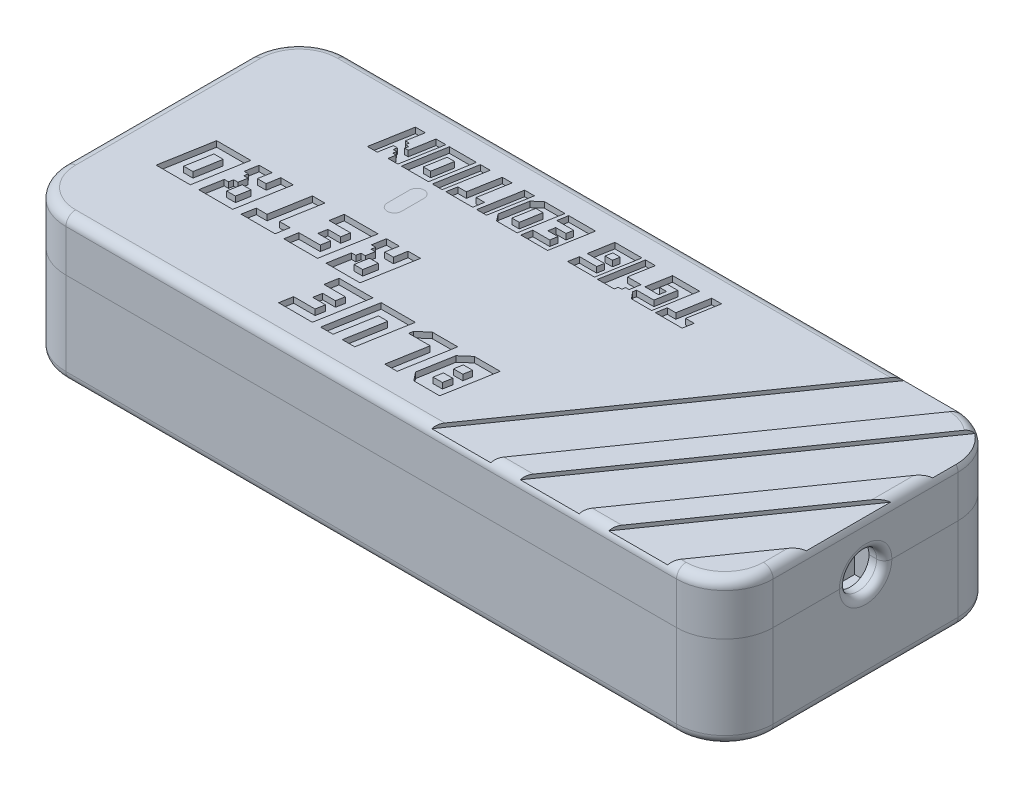
from build123d import *

# Parameters (mm, degrees)
SKETCH1_R                                  = 2
BOSS_EXTRUDE1_DEPTH                        = 0.8
SKETCH2_W                                  = 1.500000048
SKETCH2_H                                  = 4.000000128
BOSS_EXTRUDE2_DEPTH                        = 1
SKETCH3_W                                  = 48.25
SKETCH3_H                                  = 25.72
BOSS_EXTRUDE3_DEPTH                        = 4.15
SKETCH4_W                                  = 4.999999906
SKETCH4_H                                  = 2.000000064
CUT_EXTRUDE1_DEPTH                         = 0.1
SKETCH9_W                                  = 17.77
SKETCH9_H                                  = 15.77
BOSS_EXTRUDE8_DEPTH                        = 3.2
SKETCH23_W                                 = 6.24
SKETCH23_H                                 = 19.54
BOSS_EXTRUDE14_DEPTH                       = 3.32
BOX_SHAPE_DEPTH                            = 6.7945
BOX_SHAPE_DEPTH_BACK                       = 12.250000074
SKETCH5_W                                  = 92.9375
SKETCH5_H                                  = 37.000000128
CORNER_FILLETS_R                           = 6.35
TOP_SHELL_T                                = -2
BOTTOM_SHELL_T                             = -2
PCB_BOSS_HORIZONTAL_DEPTH                  = 1
PCB_BOSS_HORIZONTAL_2_DEPTH                = 1
PCB_BOSS_VERT_PATTERN_1_COUNT              = 2
PCB_BOSS_VERT_PATTERN_1_ANGLE              = 90
PCB_BOSS_VERT_PATTERN_2_COUNT              = 2
PCB_BOSS_VERT_PATTERN_2_ANGLE              = 90
SKETCH7_R                                  = 2.45
SKETCH7_R_2                                = 1.95
PCB_BOSS_EDGE_BREAK_DEPTH                  = 96.55093624
PCB_PCB_TOP_CATCH_REACH                    = 97.756
SKETCH8_R                                  = 3
SKETCH8_R_2                                = 2
BOSS_NOTCH_FOR_ESP32_REACH                 = 96.657
SKETCH10_W                                 = 3.175
SKETCH10_H                                 = 6.35
SHORT_SIDE_SNAP_FIT_FEMALE_DEPTH           = 11.5
SNAP_FIT_FILL_FOR_CORD_HOLE_REACH          = 99.513
SKETCH24_W                                 = 6.35
SKETCH24_H                                 = 3.7011433
LONG_SIDE_SNP_FIT_FEMALE_DEPTH             = 39.46875
SHORT_SIDE_SNAP_FIT_MALE_DEPTH             = 10.5
SHORT_SIDE_SNAP_FIT_MALE_DEPTH_BACK        = 10.5
LONG_SIDE_SNP_FIT_MALE_DEPTH               = 38.46875
LONG_SIDE_SNP_FIT_MALE_DEPTH_BACK          = 38.46875
SKETCH15_R                                 = 2.45
CORD_HOLE_CUT_DEPTH                        = 2
SNAPFIT_MALE_REMOVAL_FOR_CORD_HOLE_1_REACH = 97.65
SKETCH25_W                                 = 8.35
SKETCH25_H                                 = 7.7945
SKETCH26_W                                 = 8.35
SKETCH26_H                                 = 2.95
SNAPFIT_MALE_REMOVAL_FOR_CORD_HOLE_2_DEPTH = 98.512519281
CORD_HOLE_FILLET_BOTTOM_R                  = 1
CORD_HOLE_FILLET_TOP_R                     = 1
LED_HOLE_DEPTH                             = 2
TOP_EDGE_FILLET_R                          = 1.27
DIAG_LINES_CUT_DEPTH                       = 0.5
TEXT_CUT_DEPTH                             = 0.75
BOTTOM_EDGE_FILLET_R                       = 1.27
LED_DIFFUSER_MOCK_DEPTH                    = 1


with BuildPart() as part:
    # Sketch1 → Boss-Extrude1 (new, symmetric)
    with BuildSketch(Plane(origin=(0, 0, 0), x_dir=(1, 0, 0), z_dir=(0, 1, 0))):
        with BuildLine():
            Line((2, 0), (79, 0))
            ThreePointArc((79, 0), (80.414213562, 0.585786438), (81, 2))
            Line((81, 2), (81, 27))
            ThreePointArc((81, 27), (80.414213562, 28.414213562), (79, 29))
            Line((79, 29), (2, 29))
            ThreePointArc((2, 29), (0.585786438, 28.414213562), (0, 27))
            Line((0, 27), (0, 2))
            ThreePointArc((0, 2), (0.585786438, 0.585786438), (2, 0))
        make_face()
        with Locations(Location((4, 4, 0), (0, 0, 270))):
            Circle(SKETCH1_R, mode=Mode.SUBTRACT)
        with Locations(Location((4, 25, 0), (0, 0, 270))):
            Circle(SKETCH1_R, mode=Mode.SUBTRACT)
        with Locations(Location((77, 25, 0), (0, 0, 270))):
            Circle(SKETCH1_R, mode=Mode.SUBTRACT)
        with Locations(Location((77, 4, 0), (0, 0, 270))):
            Circle(SKETCH1_R, mode=Mode.SUBTRACT)
    extrude(amount=BOSS_EXTRUDE1_DEPTH, both=True)

    # Sketch2 → Boss-Extrude2 (add)
    with BuildSketch(Plane(origin=(0, 0.8, 0), x_dir=(1, 0, 0), z_dir=(0, 1, 0))):
        with Locations((23, 20)):
            Rectangle(SKETCH2_W, SKETCH2_H)
    extrude(amount=BOSS_EXTRUDE2_DEPTH)

    # Sketch3 → Boss-Extrude3 (add)
    with BuildSketch(Plane.XZ.offset(0.8)):
        with Locations((31, -15)):
            Rectangle(SKETCH3_W, SKETCH3_H)
    extrude(amount=BOSS_EXTRUDE3_DEPTH)

    # Sketch4 → Cut-Extrude1 (cut)
    with BuildSketch(Plane(origin=(0, 0.8, 0), x_dir=(1, 0, 0), z_dir=(0, 1, 0))):
        with Locations((52, 23)):
            Rectangle(SKETCH4_W, SKETCH4_H)
        with Locations((52, 13)):
            Rectangle(SKETCH4_W, SKETCH4_H)
        with Locations((52, 18)):
            Rectangle(SKETCH4_W, SKETCH4_H)
        with Locations((52, 8)):
            Rectangle(SKETCH4_W, SKETCH4_H)
    extrude(amount=-CUT_EXTRUDE1_DEPTH, mode=Mode.SUBTRACT)

    # Sketch9 → Boss-Extrude8 (add)
    with BuildSketch(Plane.XZ.offset(4.95)):
        with Locations((22.76, -15)):
            Rectangle(SKETCH9_W, SKETCH9_H)
    extrude(amount=BOSS_EXTRUDE8_DEPTH)

    # Sketch23 → Boss-Extrude14 (add)
    with BuildSketch(Plane(origin=(0, 0.8, 0), x_dir=(1, 0, 0), z_dir=(0, 1, 0))):
        with Locations((31, 15)):
            Rectangle(SKETCH23_W, SKETCH23_H)
        with Locations((43, 15)):
            Rectangle(SKETCH23_W, SKETCH23_H)
    extrude(amount=BOSS_EXTRUDE14_DEPTH)


with BuildPart() as body_2:
    # Sketch5 → Box Shape (new, two sides: drawn at the far end of the back side and taken through both)
    with BuildSketch(Plane(origin=(0, 0, 0), x_dir=(1, 0, 0), z_dir=(0, 1, 0)).offset(-BOX_SHAPE_DEPTH_BACK)):
        with Locations((42.46875, 14.500000064)):
            Rectangle(SKETCH5_W, SKETCH5_H)
    extrude(amount=BOX_SHAPE_DEPTH + BOX_SHAPE_DEPTH_BACK)

    # Corner Fillets
    corner_fillets_edges = [body_2.edges().sort_by_distance(p)[0] for p in [
        (-4, -2.727750037, -33.000000128),
        (88.9375, -2.727750037, -33.000000128),
        (88.9375, -2.727750037, 4),
        (-4, -2.727750037, 4),
    ]]
    fillet(corner_fillets_edges, radius=CORNER_FILLETS_R)


with BuildPart() as body_3:
    # Top Bottom Split: the piece on the far side of the plane
    add(body_2.part)
    split(bisect_by=Plane.ZX, keep=Keep.BOTTOM)

    # Bottom Shell
    bottom_shell_openings = [body_3.faces().sort_by_distance(p)[0] for p in [
        (42.46875, 0, -14.500000064),
    ]]
    offset(amount=BOTTOM_SHELL_T, openings=bottom_shell_openings, kind=Kind.INTERSECTION)


with BuildPart() as body_2_1:
    add(body_2.part)

    # Top Bottom Split
    split(bisect_by=Plane.ZX, keep=Keep.TOP)

    # Top Shell
    top_shell_openings = [body_2_1.faces().sort_by_distance(p)[0] for p in [
        (42.46875, 0, -14.500000064),
    ]]
    offset(amount=TOP_SHELL_T, openings=top_shell_openings, kind=Kind.INTERSECTION)


with BuildPart() as body_4:
    # Sketch6 → PCB Boss Horizontal (new, symmetric)
    with BuildSketch(Plane.XY.offset(-4.000000128)):
        Polygon((79.75, -0.8), (82.715, -10.250000074), (71.285, -10.250000074), (74.25, -0.8), (75.25, -0.8), (75.25, 3.7945), (78.75, 3.7945), (78.75, -0.8), align=None)
    extrude(amount=PCB_BOSS_HORIZONTAL_DEPTH, both=True)


with BuildPart() as body_5:
    # Sketch6 → PCB Boss Horizontal 2 (new, symmetric)
    with BuildSketch(Plane.XY.offset(-4.000000128)):
        Polygon((2.25, -0.8), (1.25, -0.8), (-1.715, -10.250000074), (9.715, -10.250000074), (6.75, -0.8), (5.75, -0.8), (5.75, 3.7945), (2.25, 3.7945), align=None)
    extrude(amount=PCB_BOSS_HORIZONTAL_2_DEPTH, both=True)


with BuildPart() as pcb_boss_vert_pattern_1_1:
    # PCB Boss Vert Pattern 1: pattern copy
    add(body_4.part.rotate(Axis((77, 0, -4), (0, 1, 0)), 1 * PCB_BOSS_VERT_PATTERN_1_ANGLE / (PCB_BOSS_VERT_PATTERN_1_COUNT - 1)))


with BuildPart() as pcb_boss_vert_pattern_2_1:
    # PCB Boss Vert Pattern 2: pattern copy
    add(body_5.part.rotate(Axis((4, 0, -4), (0, 1, 0)), 1 * PCB_BOSS_VERT_PATTERN_2_ANGLE / (PCB_BOSS_VERT_PATTERN_2_COUNT - 1)))


with BuildPart() as body_8:
    # PCB Boss Mirror 1: read off the stored shape, not the designer's step
    # PCB Boss Mirror 1: mirrored copy
    add(pcb_boss_vert_pattern_2_1.part.mirror(Plane.XY.offset(-14.5)))


with BuildPart() as body_9:
    # PCB Boss Mirror 1 2: mirrored copy
    add(body_5.part.mirror(Plane.XY.offset(-14.5)))


with BuildPart() as body_10:
    # PCB Boss Mirror 2: mirrored copy
    add(body_4.part.mirror(Plane(origin=(0, 0, -14.5), x_dir=(1, 0, 0), z_dir=(0, 0, -1))))


with BuildPart() as body_11:
    # PCB Boss Mirror 2 2: mirrored copy
    add(pcb_boss_vert_pattern_1_1.part.mirror(Plane(origin=(0, 0, -14.5), x_dir=(1, 0, 0), z_dir=(0, 0, -1))))


with BuildPart() as body_4_1:
    add(body_4.part)

    # Bottom Combine: union body 5, PCB Boss Vert Pattern 2_1, PCB Boss Vert Pattern 1_1, body 3, body 9, body 8, body 11, body 10
    add(body_5.part)
    add(pcb_boss_vert_pattern_2_1.part)
    add(pcb_boss_vert_pattern_1_1.part)
    add(body_3.part)
    add(body_9.part)
    add(body_8.part)
    add(body_11.part)
    add(body_10.part)

    # Sketch7 → PCB Boss Edge Break (cut, through all)
    # profile 1 of 4: a face of its own
    with BuildSketch(Plane(origin=(0, -0.8, 0), x_dir=(1, 0, 0), z_dir=(0, 1, 0))):
        with Locations((77, 25)):
            Circle(SKETCH7_R)
        with Locations((77, 25)):
            Circle(SKETCH7_R_2, mode=Mode.SUBTRACT)
    # profile 2 of 4: a face of its own
    with BuildSketch(Plane(origin=(0, -0.8, 0), x_dir=(1, 0, 0), z_dir=(0, 1, 0))):
        with Locations((77, 4)):
            Circle(SKETCH7_R)
        with Locations((77, 4)):
            Circle(SKETCH7_R_2, mode=Mode.SUBTRACT)
    # profile 3 of 4: a face of its own
    with BuildSketch(Plane(origin=(0, -0.8, 0), x_dir=(1, 0, 0), z_dir=(0, 1, 0))):
        with Locations((4, 4)):
            Circle(SKETCH7_R)
        with Locations((4, 4)):
            Circle(SKETCH7_R_2, mode=Mode.SUBTRACT)
    # profile 4 of 4: a face of its own
    with BuildSketch(Plane(origin=(0, -0.8, 0), x_dir=(1, 0, 0), z_dir=(0, 1, 0))):
        with Locations((4, 25)):
            Circle(SKETCH7_R)
        with Locations((4, 25)):
            Circle(SKETCH7_R_2, mode=Mode.SUBTRACT)
    extrude(amount=PCB_BOSS_EDGE_BREAK_DEPTH, mode=Mode.SUBTRACT)

    # Boss Notch for ESP32: up to this face of the body (flat: up to its plane)
    boss_notch_for_esp32_end = Plane(body_4_1.part.faces().sort_by_distance((6.601382843, -5.53442938, -25.999999872))[0])
    # Sketch10 → Boss Notch for ESP32 (cut, up to the picked face)
    with BuildSketch(Plane.XY.offset(-3.000000128), mode=Mode.PRIVATE) as boss_notch_for_esp32_sk1:
        with Locations((54.5375, -2.775)):
            Rectangle(SKETCH10_W, SKETCH10_H)
    boss_notch_for_esp32_tool1 = split(extrude(boss_notch_for_esp32_sk1.sketch, amount=-BOSS_NOTCH_FOR_ESP32_REACH, mode=Mode.PRIVATE), bisect_by=boss_notch_for_esp32_end, keep=Keep.BOTH, mode=Mode.PRIVATE)
    # Sketch10 → Boss Notch for ESP32 (cut, up to the picked face)
    with BuildSketch(Plane.XY.offset(-3.000000128), mode=Mode.PRIVATE) as boss_notch_for_esp32_sk2:
        with Locations((7.4625, -2.775)):
            Rectangle(SKETCH10_W, SKETCH10_H)
    boss_notch_for_esp32_tool2 = split(extrude(boss_notch_for_esp32_sk2.sketch, amount=-BOSS_NOTCH_FOR_ESP32_REACH, mode=Mode.PRIVATE), bisect_by=boss_notch_for_esp32_end, keep=Keep.BOTH, mode=Mode.PRIVATE)
    add(boss_notch_for_esp32_tool1.solids().sort_by(Axis((54.5375, -2.775, -3), (0, 0, -1)))[0], mode=Mode.SUBTRACT)
    add(boss_notch_for_esp32_tool2.solids().sort_by(Axis((7.4625, -2.775, -3), (0, 0, -1)))[0], mode=Mode.SUBTRACT)

    # Sketch11 → Short Side Snap Fit Female (cut, symmetric)
    with BuildSketch(Plane(origin=(0, 0, -14.500000064), x_dir=(-1, 0, 0), z_dir=(0, 0, -1))):
        with BuildLine():
            Line((-86.9375, 0), (-86.9375, -3))
            Line((-86.9375, -3), (-87.1875, -3))
            ThreePointArc((-87.1875, -3), (-87.937242994, -2.269632711), (-87.226751967, -1.501027849))
            Line((-87.226751967, -1.501027849), (-87.305417503, 0))
            Line((-87.305417503, 0), (-86.9375, 0))
        make_face()
    short_side_snap_fit_female = extrude(amount=SHORT_SIDE_SNAP_FIT_FEMALE_DEPTH, both=True, mode=Mode.SUBTRACT)

    # Snap Fit Fill for Cord Hole: up to this face of the body (flat: up to its plane)
    snap_fit_fill_for_cord_hole_end = Plane(body_4_1.part.faces().sort_by_distance((88.9375, -6.125000037, -14.500000064))[0])
    # Sketch24 → Snap Fit Fill for Cord Hole (add, up to the picked face)
    with BuildSketch(Plane.ZY.offset(-86.9375), mode=Mode.PRIVATE) as snap_fit_fill_for_cord_hole_sk1:
        with Locations((-14.500000064, -1.85057165)):
            Rectangle(SKETCH24_W, SKETCH24_H)
    snap_fit_fill_for_cord_hole_tool1 = split(extrude(snap_fit_fill_for_cord_hole_sk1.sketch, amount=-SNAP_FIT_FILL_FOR_CORD_HOLE_REACH, mode=Mode.PRIVATE), bisect_by=snap_fit_fill_for_cord_hole_end, keep=Keep.BOTH, mode=Mode.PRIVATE)
    add(snap_fit_fill_for_cord_hole_tool1.solids().sort_by(Axis((86.9375, -1.850572, -14.5), (1, 0, 0)))[0])

    # Short Side Snp Fit Female Mirror: Short Side Snap Fit Female across plane
    add(short_side_snap_fit_female.mirror(Plane.ZY.offset(-42.46875)), mode=Mode.SUBTRACT)

    # Sketch12 → Long Side Snp Fit Female (cut, symmetric)
    with BuildSketch(Plane.ZY.offset(-42.46875)):
        with BuildLine():
            Line((2.367449648, 0), (2, 0))
            Line((2, 0), (2, -3))
            Line((2, -3), (2.25, -3))
            ThreePointArc((2.25, -3), (2.999749072, -2.269399183), (2.288785386, -1.501003542))
            Line((2.288785386, -1.501003542), (2.367449648, 0))
        make_face()
    long_side_snp_fit_female = extrude(amount=LONG_SIDE_SNP_FIT_FEMALE_DEPTH, both=True, mode=Mode.SUBTRACT)

    # Long Side Snp Fit Female Mirror: Long Side Snp Fit Female across plane
    add(long_side_snp_fit_female.mirror(Plane(origin=(0, 0, -14.500000064), x_dir=(1, 0, 0), z_dir=(0, 0, -1))), mode=Mode.SUBTRACT)


with BuildPart() as body_4_2:

    # Sketch8 → PCB PCB Top Catch (new, up to next)
    with BuildSketch(Plane(origin=(0, 0.8, 0), x_dir=(1, 0, 0), z_dir=(0, 1, 0)), mode=Mode.PRIVATE) as pcb_pcb_top_catch_sk1:
        with Locations(Location((77, 4, 0), (0, 0, 90))):
            Circle(SKETCH8_R)
        with Locations(Location((77, 4, 0), (0, 0, 270))):
            Circle(SKETCH8_R_2, mode=Mode.SUBTRACT)
    pcb_pcb_top_catch_tool1 = extrude(pcb_pcb_top_catch_sk1.sketch, amount=PCB_PCB_TOP_CATCH_REACH, mode=Mode.PRIVATE) - body_2_1.part
    # Sketch8 → PCB PCB Top Catch (new, up to next)
    with BuildSketch(Plane(origin=(0, 0.8, 0), x_dir=(1, 0, 0), z_dir=(0, 1, 0)), mode=Mode.PRIVATE) as pcb_pcb_top_catch_sk2:
        with Locations(Location((77, 25, 0), (0, 0, 90))):
            Circle(SKETCH8_R)
        with Locations(Location((77, 25, 0), (0, 0, 270))):
            Circle(SKETCH8_R_2, mode=Mode.SUBTRACT)
    pcb_pcb_top_catch_tool2 = extrude(pcb_pcb_top_catch_sk2.sketch, amount=PCB_PCB_TOP_CATCH_REACH, mode=Mode.PRIVATE) - body_2_1.part
    # Sketch8 → PCB PCB Top Catch (new, up to next)
    with BuildSketch(Plane(origin=(0, 0.8, 0), x_dir=(1, 0, 0), z_dir=(0, 1, 0)), mode=Mode.PRIVATE) as pcb_pcb_top_catch_sk3:
        with Locations(Location((4, 25, 0), (0, 0, 90))):
            Circle(SKETCH8_R)
        with Locations(Location((4, 25, 0), (0, 0, 270))):
            Circle(SKETCH8_R_2, mode=Mode.SUBTRACT)
    pcb_pcb_top_catch_tool3 = extrude(pcb_pcb_top_catch_sk3.sketch, amount=PCB_PCB_TOP_CATCH_REACH, mode=Mode.PRIVATE) - body_2_1.part
    # Sketch8 → PCB PCB Top Catch (new, up to next)
    with BuildSketch(Plane(origin=(0, 0.8, 0), x_dir=(1, 0, 0), z_dir=(0, 1, 0)), mode=Mode.PRIVATE) as pcb_pcb_top_catch_sk4:
        with Locations(Location((4, 4, 0), (0, 0, 90))):
            Circle(SKETCH8_R)
        with Locations(Location((4, 4, 0), (0, 0, 270))):
            Circle(SKETCH8_R_2, mode=Mode.SUBTRACT)
    pcb_pcb_top_catch_tool4 = extrude(pcb_pcb_top_catch_sk4.sketch, amount=PCB_PCB_TOP_CATCH_REACH, mode=Mode.PRIVATE) - body_2_1.part
    add(pcb_pcb_top_catch_tool1.solids().sort_by_distance((77, 0.8, -1.084853))[0])
    add(pcb_pcb_top_catch_tool2.solids().sort_by_distance((77, 0.8, -22.084853))[0])
    add(pcb_pcb_top_catch_tool3.solids().sort_by_distance((4, 0.8, -22.084853))[0])
    add(pcb_pcb_top_catch_tool4.solids().sort_by_distance((4, 0.8, -1.084853))[0])


with BuildPart() as body_2_2:
    add(body_2_1.part)

    # Top Combine: read off the stored shape, not the designer's step
    # Top Combine: union body 4 2
    add(body_4_2.part)


with BuildPart() as body_4_3:
    # Sketch13 → Short Side Snap fit Male (new, two sides: drawn at the far end of the back side and taken through both)
    with BuildSketch(Plane(origin=(0, 0, -14.500000064), x_dir=(-1, 0, 0), z_dir=(0, 0, -1)).offset(-SHORT_SIDE_SNAP_FIT_MALE_DEPTH_BACK)):
        with BuildLine():
            Line((-85.255486027, 4.7945), (-87.255486027, 4.7945))
            Line((-87.255486027, 4.7945), (-87.255486027, 0.002616798))
            Line((-87.255486027, 0.002616798), (-87.174110116, -1.550128075))
            ThreePointArc((-87.174110116, -1.550128075), (-87.88746798, -2.243304752), (-87.1875, -2.95))
            Line((-87.1875, -2.95), (-85.9175, -2.95))
            Line((-85.9175, -2.95), (-85.255486027, 4.7945))
        make_face()
    extrude(amount=SHORT_SIDE_SNAP_FIT_MALE_DEPTH + SHORT_SIDE_SNAP_FIT_MALE_DEPTH_BACK)


with BuildPart() as body_5_2:
    # Short Side Snap fit Male Mirror: mirrored copy
    add(body_4_3.part.mirror(Plane.ZY.offset(-42.46875)))


with BuildPart() as body_6:
    # Sketch14 → Long Side Snp Fit Male (new, two sides: drawn at the far end of the back side and taken through both)
    with BuildSketch(Plane.ZY.offset(-42.46875).offset(-LONG_SIDE_SNP_FIT_MALE_DEPTH_BACK)):
        with BuildLine():
            Line((0.98, -2.95), (0.317518107, 4.7945))
            Line((0.317518107, 4.7945), (2.317518171, 4.7945))
            Line((2.317518171, 4.7945), (2.317518171, 0.002616798))
            Line((2.317518171, 0.002616798), (2.236141783, -1.550137192))
            ThreePointArc((2.236141783, -1.550137192), (2.949965701, -2.243070552), (2.25, -2.95))
            Line((2.25, -2.95), (0.98, -2.95))
        make_face()
    extrude(amount=LONG_SIDE_SNP_FIT_MALE_DEPTH + LONG_SIDE_SNP_FIT_MALE_DEPTH_BACK)


with BuildPart() as body_7:
    # Long Side Snp Fit Male Mirror: mirrored copy
    add(body_6.part.mirror(Plane(origin=(0, 0, -14.500000064), x_dir=(1, 0, 0), z_dir=(0, 0, -1))))


with BuildPart() as body_6_1:
    add(body_6.part)

    # Top Combine 2: union body 5 2, body 4 3, body 2, body 7
    add(body_5_2.part)
    add(body_4_3.part)
    add(body_2_2.part)
    add(body_7.part)


with BuildPart() as cord_hole_cut_tool:
    # Sketch15 → Cord Hole Cut (new body)
    with BuildSketch(Plane(origin=(88.9375, 0, 37.937499872), x_dir=(0, 0, 1), z_dir=(-1, 0, 0))):
        with Locations(Location((-52.437499936, 0, 0), (0, 0, 180))):
            Circle(SKETCH15_R)
    extrude(amount=CORD_HOLE_CUT_DEPTH)


with BuildPart() as body_4_4:
    add(body_4_1.part)

    # Cord Hole Cut: cut by cord_hole_cut_tool
    add(cord_hole_cut_tool.part, mode=Mode.SUBTRACT)

    # Cord Hole Fillet Bottom
    cord_hole_fillet_bottom_edges = [body_4_4.edges().sort_by_distance(p)[0] for p in [
        (88.9375, -2.45, -14.500000064),
    ]]
    fillet(cord_hole_fillet_bottom_edges, radius=CORD_HOLE_FILLET_BOTTOM_R)

    # Bottom Edge Fillet
    bottom_edge_fillet_edges = [body_4_4.edges().sort_by_distance(p)[0] for p in [
        (-4, -12.250000074, -14.500000064),
        (-2.140128061, -12.250000074, -31.140128189),
        (87.077628061, -12.250000074, -31.140128189),
        (87.077628061, -12.250000074, 2.140128061),
        (-2.140128061, -12.250000074, 2.140128061),
        (42.46875, -12.250000074, 4),
        (88.9375, -12.250000074, -14.500000064),
        (42.46875, -12.250000074, -33.000000128),
    ]]
    fillet(bottom_edge_fillet_edges, radius=BOTTOM_EDGE_FILLET_R)


with BuildPart() as body_6_2:
    add(body_6_1.part)

    # Cord Hole Cut: cut by cord_hole_cut_tool
    add(cord_hole_cut_tool.part, mode=Mode.SUBTRACT)

    # Snapfit Male Removal for Cord Hole 1: up to this face of the body (flat: up to its plane)
    snapfit_male_removal_for_cord_hole_1_end = Plane(body_6_2.part.faces().sort_by_distance((86.9375, 2.39725, -3.175000032))[0])
    # Sketch25 → Snapfit Male Removal for Cord Hole 1 (cut, up to the picked face)
    with BuildSketch(Plane.ZY, mode=Mode.PRIVATE) as snapfit_male_removal_for_cord_hole_1_sk1:
        with Locations((-14.500000064, 0.89725)):
            Rectangle(SKETCH25_W, SKETCH25_H)
    snapfit_male_removal_for_cord_hole_1_tool1 = split(extrude(snapfit_male_removal_for_cord_hole_1_sk1.sketch, amount=-SNAPFIT_MALE_REMOVAL_FOR_CORD_HOLE_1_REACH, mode=Mode.PRIVATE), bisect_by=snapfit_male_removal_for_cord_hole_1_end, keep=Keep.BOTH, mode=Mode.PRIVATE)
    add(snapfit_male_removal_for_cord_hole_1_tool1.solids().sort_by(Axis((0, 0.89725, -14.5), (1, 0, 0)))[0], mode=Mode.SUBTRACT)

    # Sketch26 → Snapfit Male Removal for Cord Hole 2 (cut, through all)
    with BuildSketch(Plane.ZY.offset(-86.9375)):
        with Locations((-14.500000064, -1.475)):
            Rectangle(SKETCH26_W, SKETCH26_H)
    extrude(amount=-SNAPFIT_MALE_REMOVAL_FOR_CORD_HOLE_2_DEPTH, mode=Mode.SUBTRACT)

    # Cord Hole Fillet Top
    cord_hole_fillet_top_edges = [body_6_2.edges().sort_by_distance(p)[0] for p in [
        (88.9375, 2.45, -14.500000064),
    ]]
    fillet(cord_hole_fillet_top_edges, radius=CORD_HOLE_FILLET_TOP_R)

    # Sketch18 → LED Hole (cut)
    with BuildSketch(Plane(origin=(0, 6.7945, 0), x_dir=(1, 0, 0), z_dir=(0, 1, 0))):
        with BuildLine():
            Line((23.947187834, 21.478545696), (23.947187834, 18.521454304))
            ThreePointArc((23.947187834, 18.521454304), (23, 17.57426647), (22.052812166, 18.521454304))
            Line((22.052812166, 18.521454304), (22.052812166, 21.478545696))
            ThreePointArc((22.052812166, 21.478545696), (23, 22.42573353), (23.947187834, 21.478545696))
        make_face()
    extrude(amount=-LED_HOLE_DEPTH, mode=Mode.SUBTRACT)

    # Top Edge Fillet
    top_edge_fillet_edges = [body_6_2.edges().sort_by_distance(p)[0] for p in [
        (42.46875, 6.7945, -33.000000128),
        (-2.140128061, 6.7945, -31.140128189),
        (-4, 6.7945, -14.500000064),
        (-2.140128061, 6.7945, 2.140128061),
        (42.46875, 6.7945, 4),
        (87.077628061, 6.7945, 2.140128061),
        (88.9375, 6.7945, -14.500000064),
        (87.077628061, 6.7945, -31.140128189),
    ]]
    fillet(top_edge_fillet_edges, radius=TOP_EDGE_FILLET_R)

    # Sketch19 → Diag Lines Cut (cut)
    with BuildSketch(Plane(origin=(0, 6.7945, 0), x_dir=(1, 0, 0), z_dir=(0, 1, 0))):
        with BuildLine():
            Line((57.744244084, -4), (83.595540926, 32.919478056))
            ThreePointArc((83.595540926, 32.919478056), (83.093125927, 32.9798376), (82.5875, 33.000000128))
            Line((82.5875, 33.000000128), (75.900004449, 33.000000128))
            Line((75.900004449, 33.000000128), (49.992325445, -4))
            Line((49.992325445, -4), (57.744244084, -4))
        make_face()
        with BuildLine():
            Line((86.553827642, 31.608905757), (61.620203403, -4))
            Line((61.620203403, -4), (69.372122042, -4))
            Line((69.372122042, -4), (88.9375, 23.942255532))
            Line((88.9375, 23.942255532), (88.9375, 26.650000128))
            ThreePointArc((88.9375, 26.650000128), (88.310640769, 29.401028979), (86.553827642, 31.608905757))
        make_face()
        Polygon((88.9375, 7.335924804), (81, -4), (73.248081361, -4), (88.9375, 18.406811956), align=None)
    extrude(amount=-DIAG_LINES_CUT_DEPTH, mode=Mode.SUBTRACT)

    # Sketch20 → Text Cut (cut)
    # profile 1 of 20: a face of its own
    with BuildSketch(Plane(origin=(0, 6.7945, 0), x_dir=(1, 0, 0), z_dir=(0, 1, 0))):
        Polygon((27.160920835, 5.090141256), (29.97524521, 5.090141256), (29.782950602, 3.999550936), (28.094355977, 3.999550936), (27.896882559, 2.87958607), (29.585477184, 2.87958607), (29.38013642, 1.715002179), (26.565812045, 1.715002179), (26.267635082, 0.023899851), (30.715055636, 0.023899851), (31.907435592, 6.786446359), (27.460015038, 6.786446359), align=None)
    # profile 2 of 20: a face of its own
    with BuildSketch(Plane(origin=(0, 6.7945, 0), x_dir=(1, 0, 0), z_dir=(0, 1, 0))):
        Polygon((33.433919111, 0.017205745), (34.328843259, 5.092742644), (35.551433299, 5.092742644), (34.656509151, 0.017205745), (36.28960533, 0.017205745), (37.482706441, 6.783844971), (32.993924044, 6.783844971), (31.800822932, 0.017205745), align=None)
    # profile 3 of 20: a face of its own
    with BuildSketch(Plane(origin=(0, 6.7945, 0), x_dir=(1, 0, 0), z_dir=(0, 1, 0))):
        Polygon((38.40391419, 5.653006131), (38.304669295, 5.090141256), (41.126704148, 5.090141256), (40.232238619, 0.017205745), (41.865334798, 0.017205745), (43.05889453, 6.786446359), (39.729493248, 6.786446359), align=None)
    # profile 4 of 20: a face of its own
    with BuildSketch(Plane(origin=(0, 6.7945, 0), x_dir=(1, 0, 0), z_dir=(0, 1, 0))):
        Polygon((43.946599065, 5.656449593), (43.151492814, 1.147028214), (43.596614402, 0.584163339), (43.589157744, 0.584163339), (44.0417349, 0.021298464), (47.441785422, 0.021298464), (48.634165378, 6.783844971), (45.234114856, 6.783844971), align=None)
        Polygon((46.510139007, 3.999550936), (45.287548968, 3.999550936), (45.480302197, 5.092742644), (46.702892236, 5.092742644), align=None, mode=Mode.SUBTRACT)
        Polygon((45.09007555, 2.87958607), (46.312665589, 2.87958607), (46.107783446, 1.717603566), (44.885193407, 1.717603566), align=None, mode=Mode.SUBTRACT)
    # profile 5 of 20: a face of its own
    with BuildSketch(Plane(origin=(0, 6.7945, 0), x_dir=(1, 0, 0), z_dir=(0, 1, 0))):
        Polygon((7.05178874, 7.643899851), (8.243710076, 14.403844971), (3.754927679, 14.403844971), (2.563006342, 7.643899851), align=None)
        Polygon((5.716869524, 9.335002179), (4.494279485, 9.335002179), (5.089846895, 12.712742644), (6.312436934, 12.712742644), align=None, mode=Mode.SUBTRACT)
    # profile 6 of 20: a face of its own
    with BuildSketch(Plane(origin=(0, 6.7945, 0), x_dir=(1, 0, 0), z_dir=(0, 1, 0))):
        Polygon((12.627518209, 7.643899851), (13.819439545, 14.403844971), (12.186343366, 14.403844971), (11.896820265, 12.761825859), (10.745622408, 12.761825859), (11.035145509, 14.403844971), (9.347202321, 14.403844971), (9.049025357, 12.712742644), (9.611890232, 12.712742644), (9.520696785, 12.195542578), (10.083561659, 12.195542578), (9.886601329, 11.078490656), (9.323736454, 11.078490656), (9.221749645, 10.500075191), (8.65888477, 10.500075191), (8.155280984, 7.643899851), align=None)
        Polygon((11.598643301, 11.070723531), (11.292598993, 9.335002179), (10.141401136, 9.335002179), (10.447445445, 11.070723531), align=None, mode=Mode.SUBTRACT)
    # profile 7 of 20: a face of its own
    with BuildSketch(Plane(origin=(0, 6.7945, 0), x_dir=(1, 0, 0), z_dir=(0, 1, 0))):
        Polygon((13.731290418, 7.643899851), (18.186422539, 7.643899851), (18.484599502, 9.335002179), (17.073582076, 9.335002179), (17.968506224, 14.410539078), (16.335408955, 14.410539078), (15.440484807, 9.335002179), (14.029467381, 9.335002179), align=None)
    # profile 8 of 20: a face of its own
    with BuildSketch(Plane(origin=(0, 6.7945, 0), x_dir=(1, 0, 0), z_dir=(0, 1, 0))):
        Polygon((20.224842345, 12.710141256), (23.03916672, 12.710141256), (22.846872111, 11.619550936), (21.158277486, 11.619550936), (20.960804068, 10.49958607), (22.649398693, 10.49958607), (22.44405793, 9.335002179), (19.629733555, 9.335002179), (19.331556592, 7.643899851), (23.778977146, 7.643899851), (24.971357102, 14.406446359), (20.523936548, 14.406446359), align=None)
    # profile 9 of 20: a face of its own
    with BuildSketch(Plane(origin=(0, 6.7945, 0), x_dir=(1, 0, 0), z_dir=(0, 1, 0))):
        Polygon((29.354706614, 7.643899851), (30.546627951, 14.403844971), (28.913531772, 14.403844971), (28.62400867, 12.761825859), (27.472810814, 12.761825859), (27.762333915, 14.403844971), (26.074390726, 14.403844971), (25.776213763, 12.712742644), (26.339078638, 12.712742644), (26.24788519, 12.195542578), (26.810750065, 12.195542578), (26.613789735, 11.078490656), (26.05092486, 11.078490656), (25.948938051, 10.500075191), (25.386073176, 10.500075191), (24.88246939, 7.643899851), align=None)
        Polygon((28.325831707, 11.070723531), (28.019787399, 9.335002179), (26.868589542, 9.335002179), (27.17463385, 11.070723531), align=None, mode=Mode.SUBTRACT)
    # profile 10 of 20: a face of its own
    with BuildSketch(Plane(origin=(0, 6.7945, 0), x_dir=(1, 0, 0), z_dir=(0, 1, 0))):
        Polygon((52.149607832, 23.651745843), (55.676587428, 23.651745843), (55.912644191, 24.990535186), (54.795588728, 24.990535186), (55.504070346, 29.008668565), (54.211201675, 29.008668565), (53.502720057, 24.990535186), (52.385664595, 24.990535186), align=None)
    # profile 11 of 20: a face of its own
    with BuildSketch(Plane(origin=(0, 6.7945, 0), x_dir=(1, 0, 0), z_dir=(0, 1, 0))):
        Polygon((48.525087234, 25.912497433), (50.327314271, 25.912497433), (50.483647394, 26.799136285), (49.572623076, 26.799136285), (49.725219382, 27.664579721), (51.091751547, 27.664579721), (50.620260681, 24.990535186), (48.362525797, 24.990535186), (48.283841359, 24.544274084), (49.017671753, 23.651745843), (51.677071727, 23.651745843), (52.620676118, 29.003369064), (49.070073425, 29.003369064), align=None)
    # profile 12 of 20: a face of its own
    with BuildSketch(Plane(origin=(0, 6.7945, 0), x_dir=(1, 0, 0), z_dir=(0, 1, 0))):
        Polygon((46.745903755, 23.646447205), (46.827716149, 24.110444603), (47.273317509, 24.110444603), (47.351886383, 24.556045962), (47.797487743, 24.556045962), (48.033544505, 25.894836167), (46.251139068, 25.894836167), (46.800173405, 29.008668565), (45.507305597, 29.008668565), (44.561833228, 23.646447205), align=None)
    # profile 13 of 20: a face of its own
    with BuildSketch(Plane(origin=(0, 6.7945, 0), x_dir=(1, 0, 0), z_dir=(0, 1, 0))):
        Polygon((44.113517007, 23.708264655), (45.047155404, 29.003369064), (41.493536006, 29.003369064), (40.948549815, 25.912497433), (43.202672069, 25.912497433), (43.050076626, 25.047053997), (40.795954371, 25.047053997), (40.559897608, 23.708264655), align=None)
        Polygon((42.550347052, 27.664579721), (43.518230833, 27.664579721), (43.365634527, 26.799136285), (42.397750746, 26.799136285), align=None, mode=Mode.SUBTRACT)
    # profile 14 of 20: a face of its own
    with BuildSketch(Plane(origin=(0, 6.7945, 0), x_dir=(1, 0, 0), z_dir=(0, 1, 0))):
        Polygon((35.185829341, 27.662520289), (37.413836138, 27.662520289), (37.261602906, 26.799136285), (35.924798828, 26.799136285), (35.768465706, 25.912497433), (37.105269784, 25.912497433), (36.942708346, 24.990535186), (34.714701549, 24.990535186), (34.478644787, 23.651745843), (37.999519392, 23.651745843), (38.943486857, 29.005428496), (35.422612252, 29.005428496), align=None)
    # profile 15 of 20: a face of its own
    with BuildSketch(Plane(origin=(0, 6.7945, 0), x_dir=(1, 0, 0), z_dir=(0, 1, 0))):
        Polygon((31.219298183, 28.110847722), (30.590915353, 24.546993259), (31.294614052, 23.649686412), (33.986320716, 23.649686412), (34.930288181, 29.003369064), (32.238581517, 29.003369064), align=None)
        Polygon((32.930235818, 24.992594618), (31.962352037, 24.992594618), (32.433479829, 27.664579721), (33.40136361, 27.664579721), align=None, mode=Mode.SUBTRACT)
    # profile 16 of 20: a face of its own
    with BuildSketch(Plane(origin=(0, 6.7945, 0), x_dir=(1, 0, 0), z_dir=(0, 1, 0))):
        Polygon((29.972914199, 23.646446342), (30.918386567, 29.008668565), (29.625518758, 29.008668565), (28.68004639, 23.646446342), align=None)
    # profile 17 of 20: a face of its own
    with BuildSketch(Plane(origin=(0, 6.7945, 0), x_dir=(1, 0, 0), z_dir=(0, 1, 0))):
        Polygon((24.624946729, 23.651745843), (28.151926324, 23.651745843), (28.387983087, 24.990535186), (27.270927624, 24.990535186), (27.979409242, 29.008668565), (26.686540571, 29.008668565), (25.978058954, 24.990535186), (24.861003491, 24.990535186), align=None)
    # profile 18 of 20: a face of its own
    with BuildSketch(Plane(origin=(0, 6.7945, 0), x_dir=(1, 0, 0), z_dir=(0, 1, 0))):
        Polygon((24.151476635, 23.646446342), (25.096949003, 29.008668565), (23.804081194, 29.008668565), (22.858608826, 23.646446342), align=None)
    # profile 19 of 20: a face of its own
    with BuildSketch(Plane(origin=(0, 6.7945, 0), x_dir=(1, 0, 0), z_dir=(0, 1, 0))):
        Polygon((22.343808662, 23.651745843), (23.287413053, 29.003369064), (19.733793655, 29.003369064), (18.790189263, 23.651745843), align=None)
        Polygon((21.286997616, 24.990535186), (20.319113834, 24.990535186), (20.790604701, 27.664579721), (21.758488482, 27.664579721), align=None, mode=Mode.SUBTRACT)
    # profile 20 of 20: a face of its own
    with BuildSketch(Plane(origin=(0, 6.7945, 0), x_dir=(1, 0, 0), z_dir=(0, 1, 0))):
        Polygon((15.6182288, 23.652631537), (15.936564519, 25.458065009), (16.452296947, 25.458065009), (16.371938575, 25.002313963), (16.817025076, 25.002313963), (16.738338051, 24.556045962), (17.197552531, 24.556045962), (17.037171262, 23.646446342), (18.330039071, 23.646446342), (19.275511439, 29.008668565), (17.98264363, 29.008668565), (17.433609293, 25.894836167), (16.974394814, 25.894836167), (17.054521199, 26.349267728), (16.609434697, 26.349267728), (16.685792356, 26.782327941), (16.170059928, 26.782327941), (16.562610221, 29.008668565), (15.26974155, 29.008668565), (14.324269182, 23.646446342), align=None)
    extrude(amount=-TEXT_CUT_DEPTH, mode=Mode.SUBTRACT)


with BuildPart() as body_4_4_1:
    # Sketch22 → LED Diffuser Mock (new body)
    with BuildSketch(Plane(origin=(0, 6.7945, 0), x_dir=(1, 0, 0), z_dir=(0, 1, 0))):
        with BuildLine():
            Line((22.052812166, 21.478545696), (22.052812166, 18.521454304))
            ThreePointArc((22.052812166, 18.521454304), (23, 17.57426647), (23.947187834, 18.521454304))
            Line((23.947187834, 18.521454304), (23.947187834, 21.478545696))
            ThreePointArc((23.947187834, 21.478545696), (23, 22.42573353), (22.052812166, 21.478545696))
        make_face()
    extrude(amount=-LED_DIFFUSER_MOCK_DEPTH)


solid = Compound([part.part, body_4_4.part, body_6_2.part, body_4_4_1.part])
